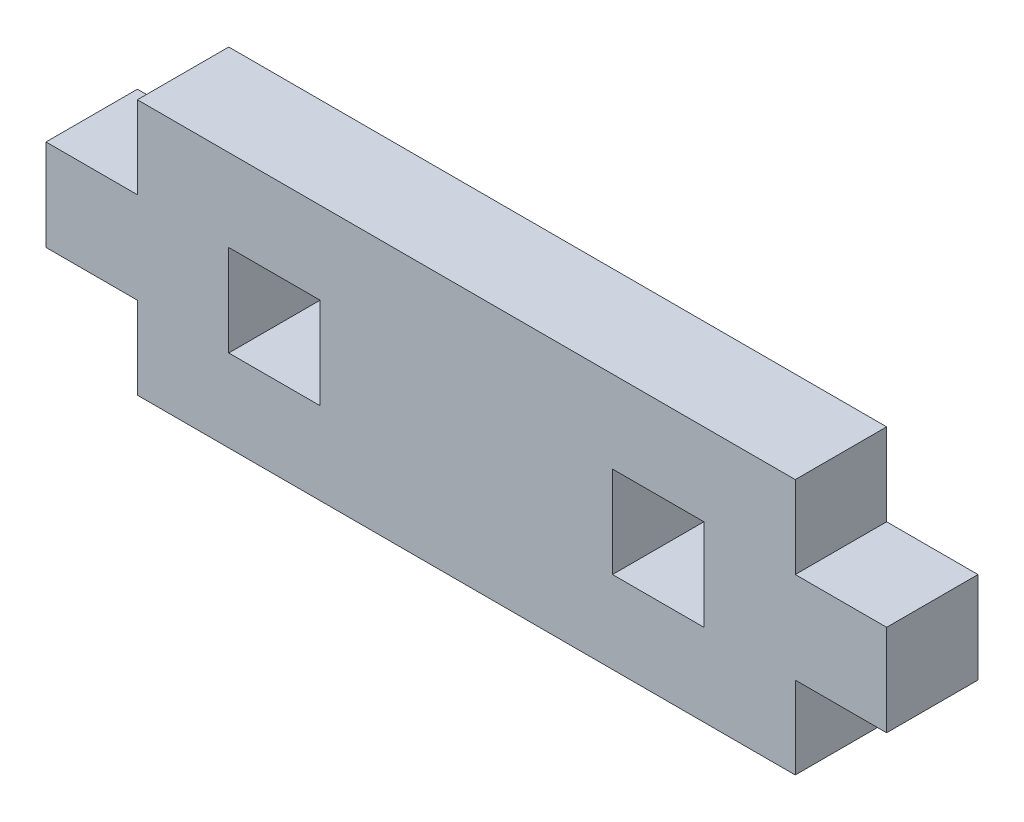
from build123d import *

# Parameters (mm, degrees)
BOSS_EXTRUDE1_DEPTH = 5
SKETCH3_W           = 5
SKETCH3_H           = 5
CUT_EXTRUDE1_DEPTH  = 49.342527861


with BuildPart() as part:
    # Sketch2 → Boss-Extrude1 (new body)
    with BuildSketch(Plane.XY):
        Polygon((0, 4.5), (0, 9.5), (5, 9.5), (5, 14), (41, 14), (41, 9.5), (46, 9.5), (46, 4.5), (41, 4.5), (41, 0), (5, 0), (5, 4.5), align=None)
    extrude(amount=BOSS_EXTRUDE1_DEPTH)

    # Sketch3 → Cut-Extrude1 (cut, through all)
    with BuildSketch(Plane.XY.offset(5)):
        with Locations((12.5, 7)):
            Rectangle(SKETCH3_W, SKETCH3_H)
        with Locations((33.5, 7)):
            Rectangle(SKETCH3_W, SKETCH3_H)
    extrude(amount=-CUT_EXTRUDE1_DEPTH, mode=Mode.SUBTRACT)


solid = part.part
